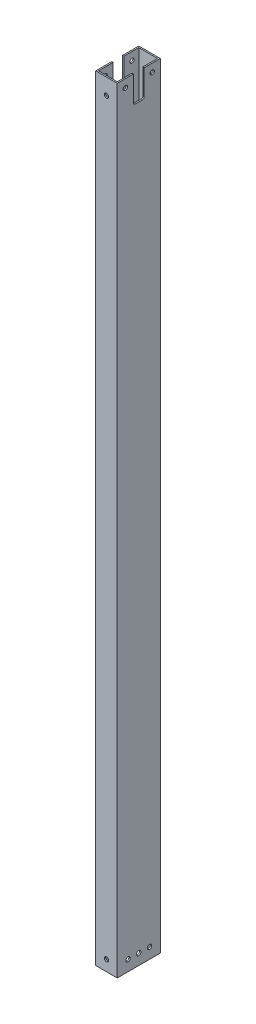
from build123d import *

# Parameters (mm, degrees)
SKETCH1_W              = 25.4
SKETCH1_H              = 50.8
SKETCH1_W_2            = 22.225
SKETCH1_H_2            = 47.625
EXTRUDE_THIN1_DEPTH    = 914.4
CUT_EXTRUDE1_DEPTH     = 916.10528356
F_10_CLEARANCE_HOLE1_D = 5.1054
F_10_CLEARANCE_HOLE2_D = 5.1054


with BuildPart() as part:
    # Sketch1 → Extrude-Thin1 (new body)
    with BuildSketch(Plane(origin=(0, 0, 0), x_dir=(1, 0, 0), z_dir=(0, 1, 0))):
        Rectangle(SKETCH1_W, SKETCH1_H)
        Rectangle(SKETCH1_W_2, SKETCH1_H_2, mode=Mode.SUBTRACT)
    extrude(amount=EXTRUDE_THIN1_DEPTH)

    # Sketch2 → Cut-Extrude1 (cut, through all)
    with BuildSketch(Plane.ZY.offset(12.7)):
        with BuildLine():
            Line((-6.35, 914.4), (6.35, 914.4))
            Line((6.35, 914.4), (6.35, 884.428))
            ThreePointArc((6.35, 884.428), (5.829235857, 883.170764143), (4.572, 882.65))
            Line((4.572, 882.65), (-4.572, 882.65))
            ThreePointArc((-4.572, 882.65), (-5.829235857, 883.170764143), (-6.35, 884.428))
            Line((-6.35, 884.428), (-6.35, 914.4))
        make_face()
    extrude(amount=-CUT_EXTRUDE1_DEPTH, mode=Mode.SUBTRACT)

    # #10 Clearance Hole1 (through all)
    with Locations(Plane.XY.offset(25.4)):
        with Locations((0, 895.35), (0, 12.7)):
            Hole(F_10_CLEARANCE_HOLE1_D / 2)

    # #10 Clearance Hole2 (through all)
    with Locations(Plane.ZY.offset(12.7)):
        with Locations((15.875, 904.875), (-15.875, 904.875), (-12.7, 12.7), (0, 12.7), (12.7, 12.7)):
            Hole(F_10_CLEARANCE_HOLE2_D / 2)


solid = part.part
